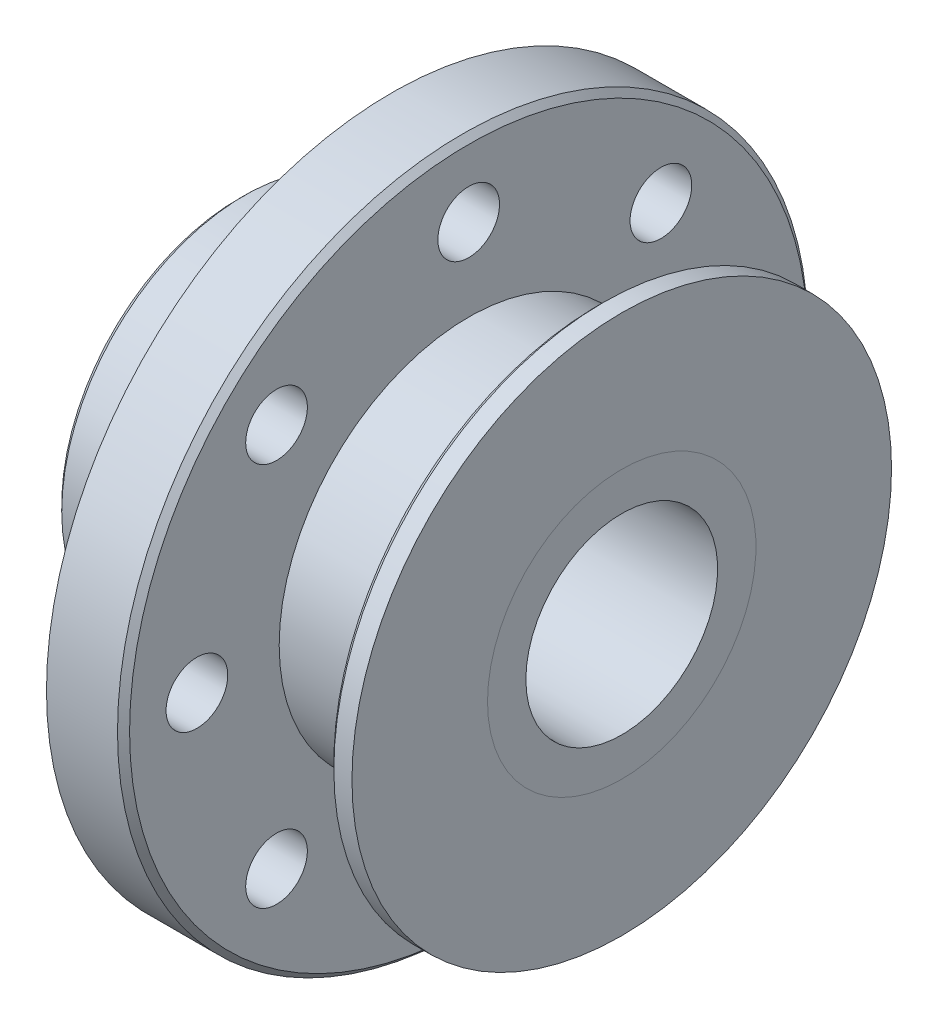
from build123d import *

# Parameters (mm, degrees)
F_1_4_20_TAPPED_HOLE1_D                     = 5.1054
F_1_4_20_TAPPED_HOLE1_DEPTH                 = 10.16
F_1_4_20_TAPPED_HOLE1_TIP                   = 1.533816902
SKETCH5_W                                   = 12.7
SKETCH5_H                                   = 3.175
CHAMFER1_SIZE                               = 0.5
TOL_SO_NEEDLE_ROLLER_SITS_FLUSH_OF_FACE_BY  = 0.1
TOL_SO_NEEDLE_ROLLER_SITS_FLUSH_OF_FACE2_BY = 0.100000054


with BuildPart() as part:
    # Sketch1 → Revolve1 (revolve)
    with BuildSketch(Plane.XY):
        Polygon((-12.7, 15.112500017), (0, 15.112500017), (0, 28.575), (6.37999994, 28.575), (6.37999994, 22.335000034), (6.37999994, 15.69), (17.04999994, 15.69), (17.04999994, 22.335000034), (19.05, 22.335000034), (19.05, 11.1125), (6.35, 11.1125), (6.35, 8.9375), (0, 8.9375), (0, 11.1125), (-12.7, 11.1125), align=None)
    revolve(axis=Axis((0, 0, 0), (1, 0, 0)))

    # 1/4-20 Tapped Hole1
    with Locations(Plane.ZY):
        with Locations((-15.909902577, -15.909902577), (-22.5, 0), (-15.909902577, 15.909902577), (0, 22.5), (15.909902577, 15.909902577), (22.5, 0), (15.909902577, -15.909902577), (0, -22.5)):
            Hole(F_1_4_20_TAPPED_HOLE1_D / 2, depth=F_1_4_20_TAPPED_HOLE1_DEPTH)
            with Locations((0, 0, -(F_1_4_20_TAPPED_HOLE1_DEPTH + F_1_4_20_TAPPED_HOLE1_TIP / 2))):  # 118° drill point
                Cone(0, F_1_4_20_TAPPED_HOLE1_D / 2, F_1_4_20_TAPPED_HOLE1_TIP, mode=Mode.SUBTRACT)

    # Chamfer1
    chamfer1_edges = [part.edges().sort_by_distance(p)[0] for p in [
        (17.04999994, -22.335000034, 0),
        (6.37999994, -28.575, 0),
        (-12.7, -15.112500017, 0),
    ]]
    chamfer(chamfer1_edges, length=CHAMFER1_SIZE)

    # Tol so Needle Roller sits flush of face: a face moved inward by 0.1
    extrude(part.faces().sort_by_distance((6.35, -5.55625, -8.89))[0], amount=TOL_SO_NEEDLE_ROLLER_SITS_FLUSH_OF_FACE_BY, dir=(-1, 0, 0), mode=Mode.SUBTRACT)

    # Tol so Needle Roller sits flush of face2: a face moved inward by 0.1
    extrude(part.faces().sort_by_distance((0, 5.55625, -8.89))[0], amount=TOL_SO_NEEDLE_ROLLER_SITS_FLUSH_OF_FACE2_BY, dir=(1, 0, 0), mode=Mode.SUBTRACT)


with BuildPart() as body_2:
    # Sketch5 → Revolve2 (revolve)
    with BuildSketch(Plane.XY):
        with Locations((12.7, 9.525)):
            Rectangle(SKETCH5_W, SKETCH5_H)
        with Locations((-6.35, 9.525)):
            Rectangle(SKETCH5_W, SKETCH5_H)
    revolve(axis=Axis((0, 0, 0), (1, 0, 0)))


solid = Compound([part.part, body_2.part])
